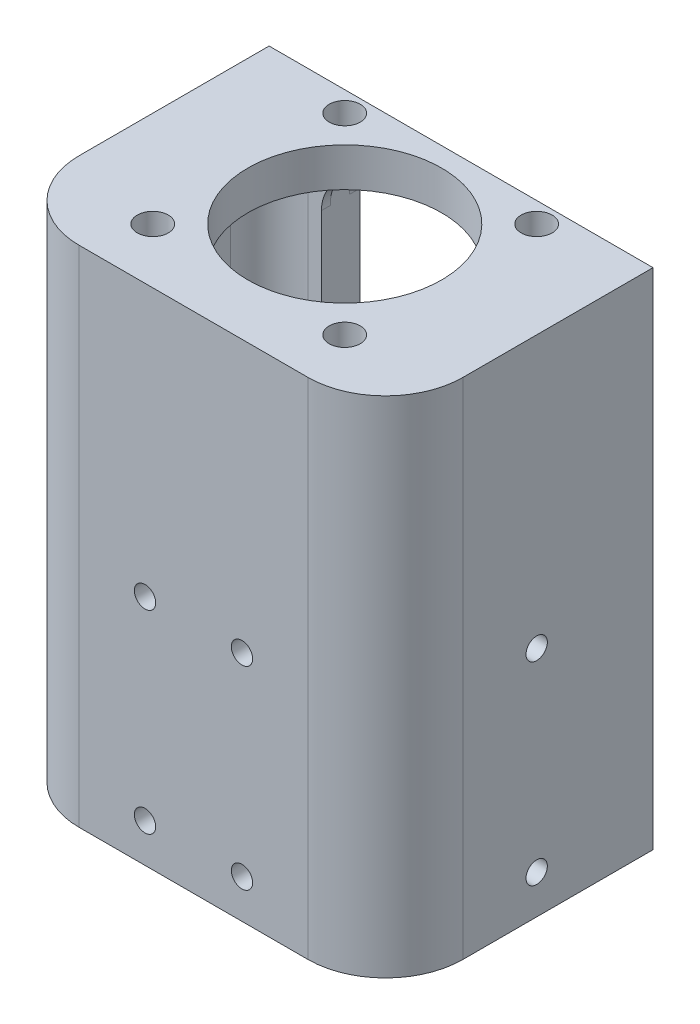
from build123d import *

# Parameters (mm, degrees)
SKETCH2_W                      = 99
SKETCH2_H                      = 69
SKETCH2_R                      = 25
BOSS_EXTRUDE1_DEPTH            = 10
BOSS_EXTRUDE2_DEPTH            = 120
CBORE_FOR_M5_SHCS1_D           = 5.5
CBORE_FOR_M5_SHCS1_CBORE_D     = 8
CBORE_FOR_M5_SHCS1_CBORE_DEPTH = 7
M5_CLEARANCE_HOLE1_D           = 5.5
M5_CLEARANCE_HOLE2_D           = 5.5
M5_CLEARANCE_HOLE2_DEPTH       = 10
SKETCH11_W                     = 10
SKETCH11_H                     = 120
BOSS_EXTRUDE3_DEPTH            = 13.5
FILLET1_R                      = 20
FILLET2_R                      = 10


with BuildPart() as part:
    # Sketch2 → Boss-Extrude1 (new body)
    with BuildSketch(Plane(origin=(0, 0, 0), x_dir=(1, 0, 0), z_dir=(0, 1, 0))):
        with Locations((0, -4.5)):
            Rectangle(SKETCH2_W, SKETCH2_H)
        with Locations(Location((0, 0, 0), (0, 0, 270))):
            Circle(SKETCH2_R, mode=Mode.SUBTRACT)
    extrude(amount=BOSS_EXTRUDE1_DEPTH)

    # Sketch3 → Boss-Extrude2 (add)
    with BuildSketch(Plane.XZ):
        Polygon((-49.5, -30), (-49.5, 39), (49.5, 39), (49.5, -30), (39.5, -30), (39.5, 29), (-39.5, 29), (-39.5, -30), align=None)
    extrude(amount=BOSS_EXTRUDE2_DEPTH)

    # CBORE for M5 SHCS1 (through all)
    with Locations(Plane(origin=(0, 10, 0), x_dir=(1, 0, 0), z_dir=(0, 1, 0))):
        with Locations((24.748737342, 24.748737342), (-24.748737342, 24.748737342), (24.748737342, -24.748737342), (-24.748737342, -24.748737342)):
            CounterBoreHole(CBORE_FOR_M5_SHCS1_D / 2, CBORE_FOR_M5_SHCS1_CBORE_D / 2, CBORE_FOR_M5_SHCS1_CBORE_DEPTH)

    # M5 Clearance Hole1 (through all)
    with Locations(Plane.XY.offset(39)):
        with Locations((-12.5, -60), (12.5, -110), (-12.5, -110), (12.5, -60)):
            Hole(M5_CLEARANCE_HOLE1_D / 2)

    # M5 Clearance Hole2
    with Locations(Plane(origin=(49.5, 0, 0), x_dir=(0, 0, -1), z_dir=(1, 0, 0))):
        with Locations((0, -60), (0, -110)):
            Hole(M5_CLEARANCE_HOLE2_D / 2, depth=M5_CLEARANCE_HOLE2_DEPTH)

    # Sketch11 → Boss-Extrude3 (add)
    with BuildSketch(Plane(origin=(-39.5, 0, 0), x_dir=(0, 0, -1), z_dir=(1, 0, 0))):
        with Locations((25, -60)):
            Rectangle(SKETCH11_W, SKETCH11_H)
    extrude(amount=BOSS_EXTRUDE3_DEPTH)

    # Fillet1
    fillet1_edges = [part.edges().sort_by_distance(p)[0] for p in [
        (49.5, -55, 39),
        (-49.5, -55, 39),
    ]]
    fillet(fillet1_edges, radius=FILLET1_R)

    # Fillet2
    # the kernel refuses this fillet: 10 mm, written as the material it adds along each edge
    with BuildSketch(Plane(origin=(39.5, 0, -30), x_dir=(0, -1, 0), z_dir=(0, 0, 1))) as fillet2_piece_1:
        with BuildLine():
            CenterArc((FILLET2_R, -FILLET2_R), FILLET2_R, 90, 90)
            Line((0, -FILLET2_R), (0, 0))
            Line((0, 0), (FILLET2_R, 0))
        make_face()
    extrude(amount=59)
    with BuildSketch(Plane(origin=(-39.5, 0, 29), x_dir=(1, 0, 0), z_dir=(0, 0, -1))) as fillet2_piece_2:
        with BuildLine():
            CenterArc((FILLET2_R, FILLET2_R), FILLET2_R, 180, 90)
            Line((0, FILLET2_R), (0, 0))
            Line((0, 0), (FILLET2_R, 0))
        make_face()
    extrude(amount=49)
    with BuildSketch(Plane(origin=(-39.5, 0, 29), x_dir=(0, 0, -1), z_dir=(0, -1, 0))) as fillet2_piece_3:
        with BuildLine():
            CenterArc((FILLET2_R, FILLET2_R), FILLET2_R, 180, 90)
            Line((0, FILLET2_R), (0, 0))
            Line((0, 0), (FILLET2_R, 0))
        make_face()
    extrude(amount=120)
    with BuildSketch(Plane(origin=(39.5, 0, 29), x_dir=(0, 0, -1), z_dir=(0, -1, 0)), Plane(origin=(-39.5, -120, -20), x_dir=(1, 0, 0), z_dir=(0, 1, 0))) as fillet2_piece_4:
        with BuildLine():
            CenterArc((FILLET2_R, -FILLET2_R), FILLET2_R, 90, 90)
            Line((0, -FILLET2_R), (0, 0))
            Line((0, 0), (FILLET2_R, 0))
        make_face()
    extrude(amount=120)
    with BuildSketch(Plane(origin=(-26, 0, -2.197582327), x_dir=(1, 0, 0), z_dir=(0, 0, -1))) as fillet2_piece_5_section:
        with BuildLine():
            CenterArc((FILLET2_R, FILLET2_R), FILLET2_R, 180, 90)
            Line((0, FILLET2_R), (0, 0))
            Line((0, 0), (FILLET2_R, 0))
        make_face()
    fillet2_piece_5 = extrude(amount=27.802417673, mode=Mode.PRIVATE)
    fillet2_piece_5 = split(fillet2_piece_5, bisect_by=Plane(origin=(-18.601224516, -0.292097945, -20), z_dir=(0, 0, -1)), keep=Keep.TOP, mode=Mode.PRIVATE)
    fillet2_piece_5 = fillet2_piece_5 - Plane(origin=(-24.748737342, -0.292097945, -24.748737342), x_dir=(-1, 0, 0), z_dir=(0, -1, 0)) * Cylinder(2.75, 96, mode=Mode.PRIVATE)
    add(fillet2_piece_5)


solid = part.part
